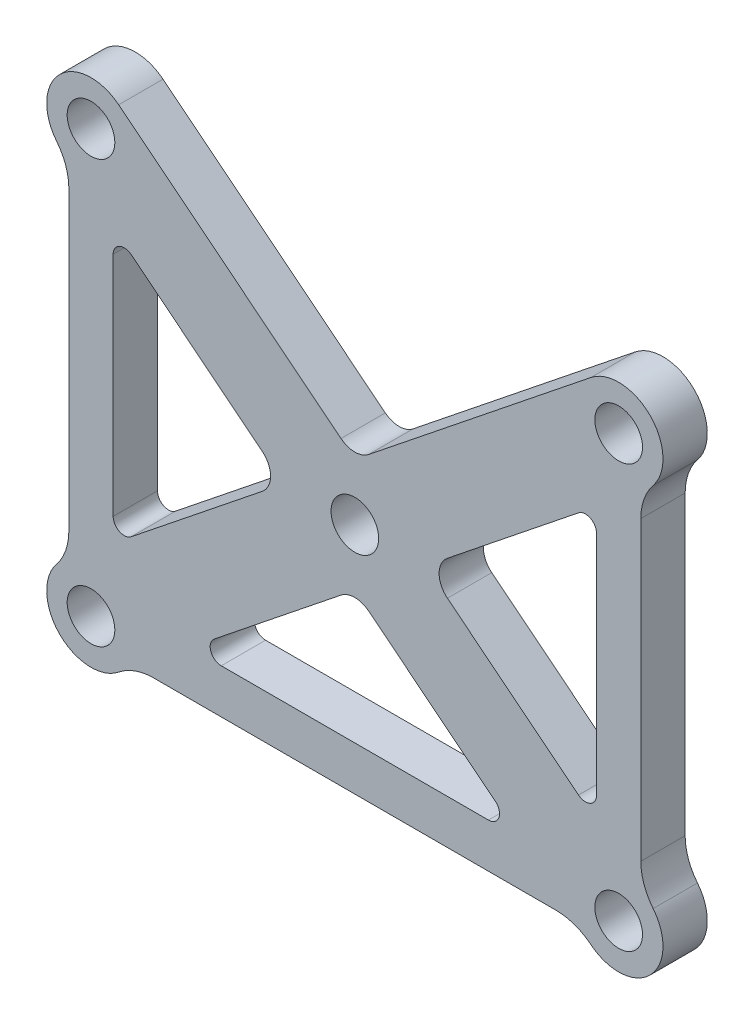
from build123d import *

# Parameters (mm, degrees)
SKETCH1_R           = 2.15
BOSS_EXTRUDE1_DEPTH = 4
FILLET1_R           = 2
FILLET2_R           = 5
FILLET3_R           = 1


with BuildPart() as part:
    # Sketch1 → Boss-Extrude1 (new body)
    with BuildSketch(Plane.XY):
        with BuildLine():
            ThreePointArc((-2.49878019, 3.123475238), (-3.123475238, -2.49878019), (2.49878019, -3.123475238))
            Line((2.49878019, -3.123475238), (3.903124237, -2))
            Line((3.903124237, -2), (43.721875763, -2))
            Line((43.721875763, -2), (45.12621981, -3.123475238))
            ThreePointArc((45.12621981, -3.123475238), (50.748475238, -2.49878019), (50.12378019, 3.123475238))
            Line((50.12378019, 3.123475238), (49.625, 3.52249939))
            Line((49.625, 3.52249939), (49.625, 34.57750061))
            Line((49.625, 34.57750061), (50.12378019, 34.976524762))
            ThreePointArc((50.12378019, 34.976524762), (50.748475238, 40.59878019), (45.12621981, 41.223475238))
            Line((45.12621981, 41.223475238), (23.8125, 24.17249939))
            Line((23.8125, 24.17249939), (2.49878019, 41.223475238))
            ThreePointArc((2.49878019, 41.223475238), (-3.123475238, 40.59878019), (-2.49878019, 34.976524762))
            Line((-2.49878019, 34.976524762), (-2, 34.57750061))
            Line((-2, 34.57750061), (-2, 3.52249939))
            Line((-2, 3.52249939), (-2.49878019, 3.123475238))
        make_face()
        Circle(SKETCH1_R, mode=Mode.SUBTRACT)
        Polygon((8.903124237, 2), (23.8125, 13.92750061), (38.721875763, 2), align=None, mode=Mode.SUBTRACT)
        Polygon((17.409375763, 19.05), (2, 6.72249939), (2, 31.37750061), align=None, mode=Mode.SUBTRACT)
        with Locations((23.8125, 19.05)):
            Circle(SKETCH1_R, mode=Mode.SUBTRACT)
        with Locations((47.625, 0)):
            Circle(SKETCH1_R, mode=Mode.SUBTRACT)
        with Locations((0, 38.1)):
            Circle(SKETCH1_R, mode=Mode.SUBTRACT)
        Polygon((30.215624237, 19.05), (45.625, 31.37750061), (45.625, 6.72249939), align=None, mode=Mode.SUBTRACT)
        with Locations((47.625, 38.1)):
            Circle(SKETCH1_R, mode=Mode.SUBTRACT)
    extrude(amount=BOSS_EXTRUDE1_DEPTH)

    # Fillet1
    fillet1_edges = [part.edges().sort_by_distance(p)[0] for p in [
        (23.8125, 13.92750061, 2),
        (30.215624237, 19.05, 2),
        (17.409375763, 19.05, 2),
        (23.8125, 24.17249939, 2),
    ]]
    fillet(fillet1_edges, radius=FILLET1_R)

    # Fillet2
    fillet2_edges = [part.edges().sort_by_distance(p)[0] for p in [
        (-2, 34.57750061, 2),
        (49.625, 34.57750061, 2),
        (49.625, 3.52249939, 2),
        (43.721875763, -2, 2),
        (3.903124237, -2, 2),
        (-2, 3.52249939, 2),
    ]]
    fillet(fillet2_edges, radius=FILLET2_R)

    # Fillet3
    fillet3_edges = [part.edges().sort_by_distance(p)[0] for p in [
        (45.625, 6.72249939, 2),
        (45.625, 31.37750061, 2),
        (38.721875763, 2, 2),
        (8.903124237, 2, 2),
        (2, 6.72249939, 2),
        (2, 31.37750061, 2),
    ]]
    fillet(fillet3_edges, radius=FILLET3_R)


solid = part.part
